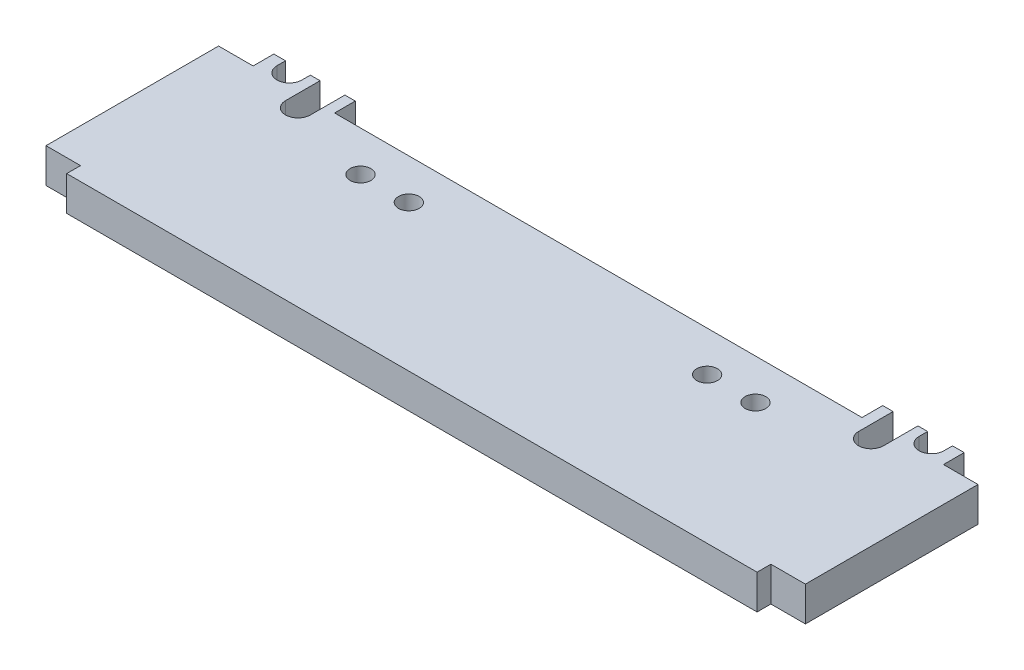
from build123d import *

# Parameters (mm, degrees)
SKETCH1_W                  = 27
SKETCH1_H                  = 5
BOSS_EXTRUDE1_DEPTH        = 110
M3_TAPPED_HOLE1_AT_2_COUNT = 2
M3_TAPPED_HOLE1_AT_2_PITCH = 7
SKETCH6_W                  = 5
SKETCH6_H                  = 2
CUT_EXTRUDE1_DEPTH         = 10
BOSS_EXTRUDE2_DEPTH        = 5
CUT_EXTRUDE2_DEPTH         = 10
CUT_EXTRUDE3_DEPTH         = 10


with BuildPart() as part:
    # Sketch1 → Boss-Extrude1 (new body)
    with BuildSketch(Plane(origin=(0, 0, 0), x_dir=(0, 0, -1), z_dir=(1, 0, 0))):
        with Locations((-3.636889684, 3.101965352)):
            Rectangle(SKETCH1_W, SKETCH1_H)
    extrude(amount=BOSS_EXTRUDE1_DEPTH)

    # Sketch14 → M3 Tapped Hole1 (revolve, cut)
    with BuildSketch(Plane(origin=(26.397029049, 5.601965352, -4.022332737), x_dir=(0, 0, 1), z_dir=(1, 0, 0))):
        Polygon((0, 0), (0, 8.251075774), (1.25, 7.5), (1.25, 6), (1.5, 6), (1.5, 0), align=None)
    m3_tapped_hole1 = revolve(axis=Axis((26.397029049, 11.951965352, -4.022332737), (0, -1, 0)), mode=Mode.SUBTRACT)

    # M3 Tapped Hole1 at 2: M3 Tapped Hole1 ×2
    with Locations(*[(i * M3_TAPPED_HOLE1_AT_2_PITCH, 0, 0) for i in range(1, M3_TAPPED_HOLE1_AT_2_COUNT)]):
        add(m3_tapped_hole1, mode=Mode.SUBTRACT)

    # Mirror3: M3 Tapped Hole1 across plane
    add(m3_tapped_hole1.mirror(Plane(origin=(55, 0, 0), x_dir=(0, 0, 1), z_dir=(1, 0, 0))), mode=Mode.SUBTRACT)

    # Mirror3 copy 1 sketch → Mirror3 copy 1 (revolve, cut)
    with BuildSketch(Plane(origin=(76.602970951, 5.601965352, -4.022332737), x_dir=(0, 0, 1), z_dir=(-1, 0, 0))):
        Polygon((0, 0), (0, -8.251075774), (1.25, -7.5), (1.25, -6), (1.5, -6), (1.5, 0), align=None)
    revolve(axis=Axis((76.602970951, 11.951965352, -4.022332737), (0, 1, 0)), mode=Mode.SUBTRACT)

    # Sketch6 → Cut-Extrude1 (cut)
    with BuildSketch(Plane(origin=(0, 5.601965352, 0), x_dir=(1, 0, 0), z_dir=(0, 1, 0))):
        with Locations((2.5, -16.136889684)):
            Rectangle(SKETCH6_W, SKETCH6_H)
    cut_extrude1 = extrude(amount=-CUT_EXTRUDE1_DEPTH, mode=Mode.SUBTRACT)

    # Mirror4: Cut-Extrude1 across plane
    add(cut_extrude1.mirror(Plane(origin=(55, 0, 0), x_dir=(0, 0, 1), z_dir=(1, 0, 0))), mode=Mode.SUBTRACT)

    # Sketch17 → Boss-Extrude2 (add)
    with BuildSketch(Plane(origin=(0, 5.601965352, 0), x_dir=(1, 0, 0), z_dir=(0, 1, 0))):
        Polygon((105, 9.863110316), (105, 12.863110316), (103.25, 12.863110316), (99.674047562, 12.863110316), (93.200232163, 12.863110316), (93.200232163, 9.863110316), (97.924047562, 9.863110316), align=None)
    boss_extrude2 = extrude(amount=-BOSS_EXTRUDE2_DEPTH)

    # Mirror5: Boss-Extrude2 across plane
    add(boss_extrude2.mirror(Plane.ZY.offset(-55)))

    # Sketch21 → Cut-Extrude2 (cut)
    with BuildSketch(Plane(origin=(0, 5.601965352, 0), x_dir=(1, 0, 0), z_dir=(0, 1, 0))):
        with BuildLine():
            Line((96.503067422, 12.863110316), (98.303067422, 12.863110316))
            Line((98.303067422, 12.863110316), (98.303067422, 7.863110316))
            ThreePointArc((98.303067422, 7.863110316), (96.502819365, 6.062862258), (94.702571307, 7.863110316))
            Line((94.702571307, 7.863110316), (94.702571307, 12.863110316))
            Line((94.702571307, 12.863110316), (96.503067422, 12.863110316))
        make_face()
    cut_extrude2 = extrude(amount=-CUT_EXTRUDE2_DEPTH, mode=Mode.SUBTRACT)

    # Sketch22 → Cut-Extrude3 (cut)
    with BuildSketch(Plane(origin=(0, 5.601965352, 0), x_dir=(1, 0, 0), z_dir=(0, 1, 0))):
        with BuildLine():
            Line((101.505065332, 12.863110316), (103.305065332, 12.863110316))
            Line((103.305065332, 12.863110316), (103.305065332, 11.629109743))
            ThreePointArc((103.305065332, 11.629109743), (101.505065332, 9.829109743), (99.705065332, 11.629109743))
            Line((99.705065332, 11.629109743), (99.705065332, 12.863110316))
            Line((99.705065332, 12.863110316), (101.505065332, 12.863110316))
        make_face()
    cut_extrude3 = extrude(amount=-CUT_EXTRUDE3_DEPTH, mode=Mode.SUBTRACT)

    # Mirror6: Cut-Extrude2, Cut-Extrude3 across plane
    add(cut_extrude2.mirror(Plane.ZY.offset(-55)), mode=Mode.SUBTRACT)
    add(cut_extrude3.mirror(Plane.ZY.offset(-55)), mode=Mode.SUBTRACT)


solid = part.part
